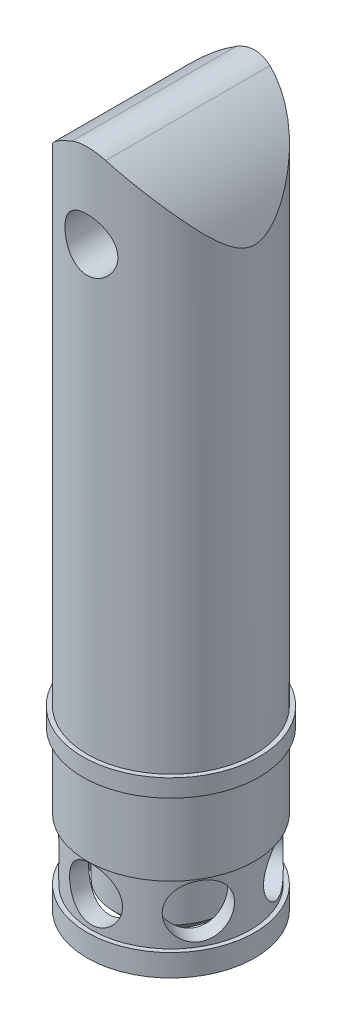
from build123d import *

# Parameters (mm, degrees)
SKETCH1_R               = 4.749999999999999
BOSS_EXTRUDE1_DEPTH     = 40
CUT_EXTRUDE1_DEPTH      = 41.56014053230092
CUT_EXTRUDE1_DEPTH_BACK = 41.56014053230092
FILLET1_R               = 2
SKETCH3_W               = 0.25
SKETCH3_H               = 1
SKETCH4_R               = 1.5000000000000009
CUT_EXTRUDE2_DEPTH      = 41.620192023179804
CIRPATTERN1_COUNT       = 3
CUT_EXTRUDE3_DEPTH      = 41.620192023179804
CUT_EXTRUDE3_DEPTH_BACK = 41.620192023179804
SKETCH8_R               = 1.5000000000000002


with BuildPart() as part:
    # Sketch1 → Boss-Extrude1 (new body)
    with BuildSketch(Plane(origin=(0, 0, 0), x_dir=(1, 0, 0), z_dir=(0, 1, 0))):
        Circle(SKETCH1_R)
    extrude(amount=-BOSS_EXTRUDE1_DEPTH)

    # Sketch2 → Cut-Extrude1 (cut, two sides: drawn at the far end of the back side and taken through both)
    with BuildSketch(Plane.XY.offset(-CUT_EXTRUDE1_DEPTH_BACK)):
        with BuildLine():
            Line((-4.749999999999999, -5.000000000000001), (-4.749999999999999, 0))
            Line((-4.749999999999999, 0), (0, 1.9999999999999991))
            Line((0, 1.9999999999999991), (4.749999999999999, 0))
            Line((4.749999999999999, 0), (4.75, -5))
            ThreePointArc((4.75, -5), (2.9414548471892443, -1.9618678951702178), (0, 0))
            ThreePointArc((0, 0), (-2.9414548471892434, -1.9618678951702186), (-4.749999999999999, -5.000000000000001))
        make_face()
    extrude(amount=CUT_EXTRUDE1_DEPTH + CUT_EXTRUDE1_DEPTH_BACK, mode=Mode.SUBTRACT)

    # Fillet1
    fillet1_edges = [part.edges().sort_by_distance(p)[0] for p in [
        (4.4e-16, 4.4e-16, 0),
    ]]
    fillet(fillet1_edges, radius=FILLET1_R)

    # Sketch3 → Revolve1 (revolve)
    with BuildSketch(Plane.XY):
        with Locations((4.874999999999999, -30.500000000000004)):
            Rectangle(SKETCH3_W, SKETCH3_H)
    revolve(axis=Axis((0, -40, 0), (0, 1, 0)))

    # Sketch4 → Cut-Extrude2 (cut, symmetric)
    with BuildSketch(Plane.XY):
        with Locations((0, -37)):
            Circle(SKETCH4_R)
    cut_extrude2 = extrude(amount=CUT_EXTRUDE2_DEPTH, both=True, mode=Mode.SUBTRACT)

    # CirPattern1: Cut-Extrude2 ×3 about axis
    cirpattern1_axis = Axis((0, -40, 0), (0, 1, 0))
    for i in range(1, CIRPATTERN1_COUNT):
        add(cut_extrude2.rotate(cirpattern1_axis, i * 360 / CIRPATTERN1_COUNT), mode=Mode.SUBTRACT)

    # Sketch5 → Cut-Revolve1 (revolve, cut)
    with BuildSketch(Plane.XY):
        Polygon((-4.249999999999998, -40), (-3.5, -38.5), (-3.5, -33), (-3e-17, -33), (0, -40), align=None)
    revolve(axis=Axis((-3e-17, -33, 0), (0, -1, 0)), mode=Mode.SUBTRACT)

    # Sketch6 → Cut-Revolve2 (revolve, cut)
    with BuildSketch(Plane.XY):
        Polygon((4.749999999999999, -38.75), (4.499999999999999, -38.75), (4.499999999999998, -35.25), (4.749999999999998, -35.25), align=None)
    revolve(axis=Axis((0, -40, 0), (0, 1, 0)), mode=Mode.SUBTRACT)

    # Sketch7 → Revolve2 (revolve)
    with BuildSketch(Plane.XY):
        with BuildLine():
            Line((-3.2, -38.5), (-3.2, -33))
            Line((-3.2, -33), (4.3e-16, -33))
            Line((4.3e-16, -33), (0, -40))
            ThreePointArc((0, -40), (-1.7670597047072294, -39.60639403670876), (-3.2, -38.5))
        make_face()
    revolve(axis=Axis((4.3e-16, -33, 0), (-6e-17, -1, 0)))

    # Sketch8 → Cut-Extrude3 (cut, two sides: drawn at the far end of the back side and taken through both)
    with BuildSketch(Plane.XY.offset(-CUT_EXTRUDE3_DEPTH_BACK)):
        with Locations((0, -5)):
            Circle(SKETCH8_R)
    extrude(amount=CUT_EXTRUDE3_DEPTH + CUT_EXTRUDE3_DEPTH_BACK, mode=Mode.SUBTRACT)


solid = part.part
